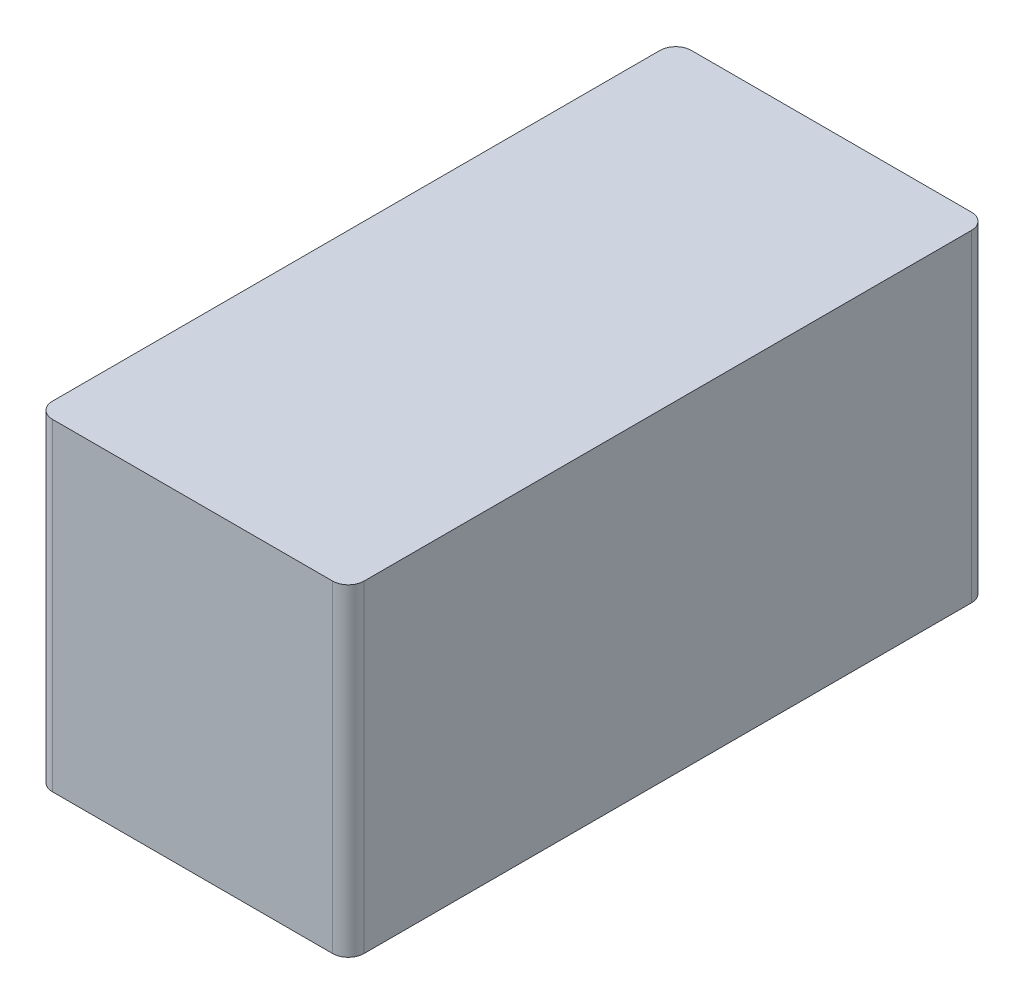
from build123d import *

# Parameters (mm, degrees)
SKETCH1_W           = 19.8
SKETCH1_H           = 40.6
BOSS_EXTRUDE1_DEPTH = 10.25
FILLET1_R           = 1


with BuildPart() as part:
    # Sketch1 → Boss-Extrude1 (new, symmetric)
    with BuildSketch(Plane(origin=(0, 0, 0), x_dir=(1, 0, 0), z_dir=(0, 1, 0))):
        Rectangle(SKETCH1_W, SKETCH1_H)
    extrude(amount=BOSS_EXTRUDE1_DEPTH, both=True)

    # Fillet1
    fillet1_edges = [part.edges().sort_by_distance(p)[0] for p in [
        (-9.9, 0, -20.3),
        (9.9, 0, -20.3),
        (9.9, 0, 20.3),
        (-9.9, 0, 20.3),
    ]]
    fillet(fillet1_edges, radius=FILLET1_R)


solid = part.part
